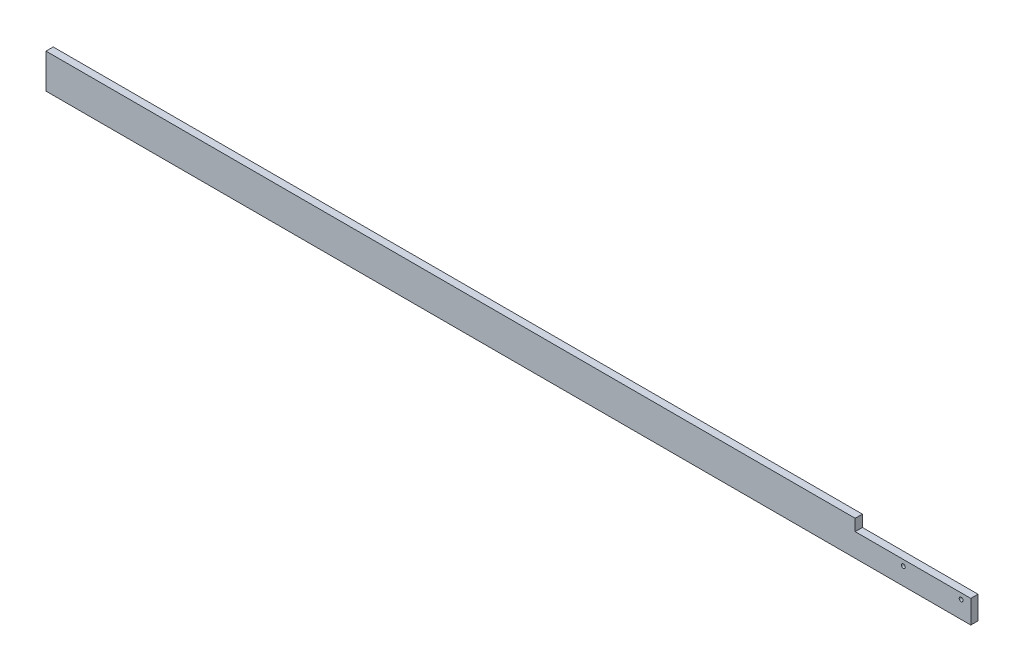
from build123d import *

# Parameters (mm, degrees)
SKETCH1_W           = 609.6
SKETCH1_H           = 22.86
BOSS_EXTRUDE1_DEPTH = 2.38125
SKETCH3_R           = 1.27
SKETCH3_W           = 76.2
SKETCH3_H           = 7.62
CUT_EXTRUDE2_DEPTH  = 306.05141584


with BuildPart() as part:
    # Sketch1 → Boss-Extrude1 (new, symmetric)
    with BuildSketch(Plane.XY):
        Rectangle(SKETCH1_W, SKETCH1_H)
    extrude(amount=BOSS_EXTRUDE1_DEPTH, both=True)

    # Sketch3 → Cut-Extrude2 (cut, through all)
    with BuildSketch(Plane.XY.offset(2.38125)):
        with Locations((260.35, 0)):
            Circle(SKETCH3_R)
        with Locations((298.45, 0)):
            Circle(SKETCH3_R)
        with Locations((266.7, 7.62)):
            Rectangle(SKETCH3_W, SKETCH3_H)
    extrude(amount=-CUT_EXTRUDE2_DEPTH, mode=Mode.SUBTRACT)


solid = part.part
